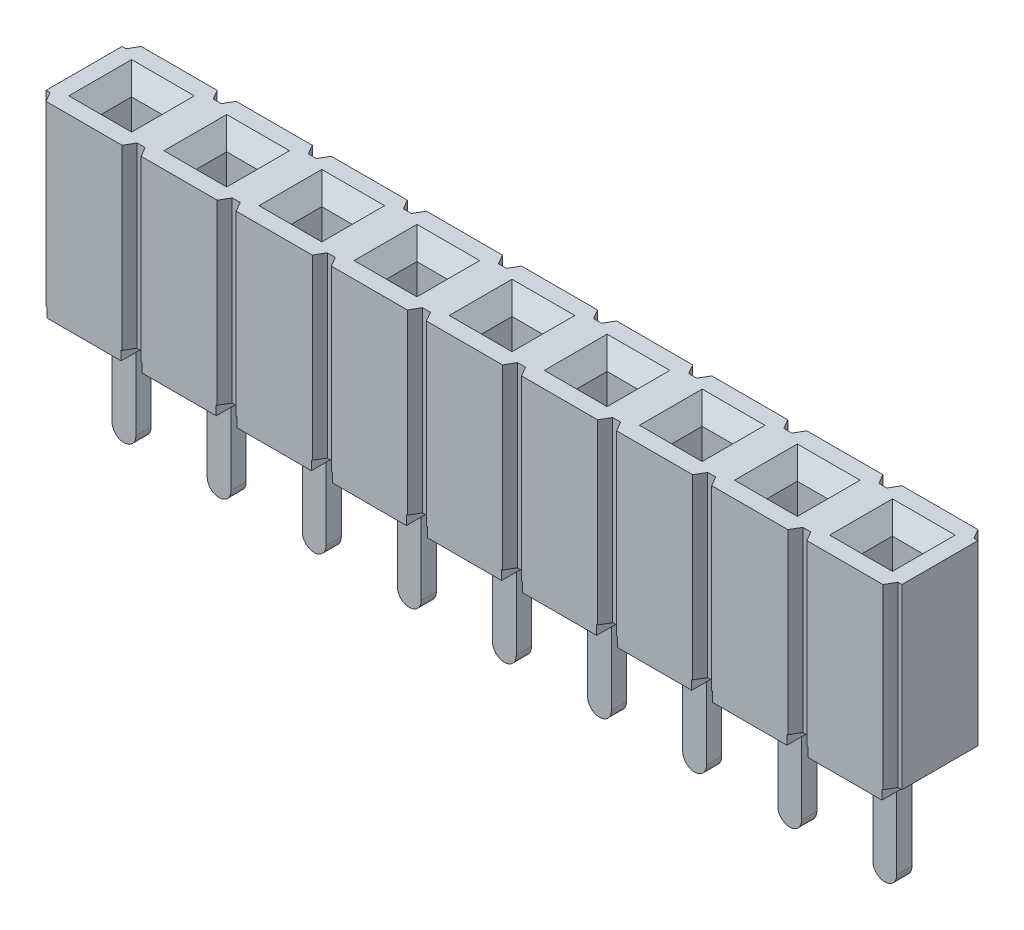
from build123d import *

# Parameters (mm, degrees)
SKETCH1_W                      = 40.64
SKETCH1_H                      = 2.54
BASE_EXTRUDE_DEPTH             = 5
SKETCH2_W                      = 1.524
SKETCH2_H                      = 0.254
STANDOFF_WIDTH_DEPTH           = 41.966114046
UPPER_START                    = -19.4945
UPPER_CORE_OUTLINE_W           = 3.3528
UPPER_CORE_OUTLINE_H           = 0.889
UPPER_CORE_DEPTH               = 0.889
LEAD_IN_SIZE                   = 0.3937
LEAD_IN_SIZE2                  = 0.469193389
CORE_PATTERN_COUNT             = 16
CORE_PATTERN_PITCH             = 2.54
LEAD_IN_OF_CORE_PATTERN_SIZE2  = 0.469193389
LEAD_IN_OF_CORE_PATTERN_SIZE   = 0.3937
POSITION_CUT_DEPTH             = 21.964620197
SKETCH10_W                     = 0.2794
SKETCH10_H                     = 0.254
STANDOFF_LENGTH_DEPTH          = 22.07970588
STANDOFF_PATTERN_COUNT         = 16
STANDOFF_PATTERN_PITCH         = 2.54
SKETCH11_W                     = 0.635
SKETCH11_H                     = 0.4064
TAIL_DEPTH                     = 3.175
TAIL_FILLETS_R                 = 0.3175
TAIL_PATTERN_COUNT             = 16
TAIL_PATTERN_PITCH             = 2.54
TAIL_FILLETS_OF_TAIL_PATTERN_R = 0.3175
SKETCH12_W                     = 17.78
SKETCH12_H                     = 7.921
CUT_EXTRUDE1_DEPTH             = 22.07970588


# Read off the part's stored shape, not the designer's step: Upper Core
with BuildPart() as part:
    # Sketch1 → Base-Extrude (new body)
    with BuildSketch(Plane(origin=(0, 0, 0), x_dir=(1, 0, 0), z_dir=(0, 1, 0))):
        Rectangle(SKETCH1_W, SKETCH1_H)
    extrude(amount=BASE_EXTRUDE_DEPTH)

    # Sketch2 → Standoff - Width (cut, through all)
    with BuildSketch(Plane.ZY.offset(20.32)):
        with Locations((0, 0.127)):
            Rectangle(SKETCH2_W, SKETCH2_H)
    extrude(amount=-STANDOFF_WIDTH_DEPTH, mode=Mode.SUBTRACT)

    # Upper Core outline → Upper Core (cut)
    with BuildSketch(Plane.YZ.offset(UPPER_START)):
        with Locations((3.3236, 0)):
            Rectangle(UPPER_CORE_OUTLINE_W, UPPER_CORE_OUTLINE_H)
    upper_core = extrude(amount=UPPER_CORE_DEPTH, mode=Mode.SUBTRACT)

    # Lead-in
    lead_in_edges = [part.edges().sort_by_distance(p)[0] for p in [
        (-19.4945, 5, 0),
        (-19.05, 5, 0.4445),
        (-18.6055, 5, 0),
        (-19.05, 5, -0.4445),
    ]]
    lead_in_side = [part.faces().sort_by_distance(p)[0] for p in [
        (0.146976854, 5, 0),
    ]]
    chamfer(lead_in_edges, length=LEAD_IN_SIZE, length2=LEAD_IN_SIZE2, reference=lead_in_side[0])

    # Core Pattern: Upper Core ×16
    with Locations(*[(i * CORE_PATTERN_PITCH, 0, 0) for i in range(1, CORE_PATTERN_COUNT)]):
        add(upper_core, mode=Mode.SUBTRACT)

    # Lead-in of Core Pattern
    lead_in_of_core_pattern_edges = [part.edges().sort_by_distance(p)[0] for p in [
        (-16.9545, 5, 0),
        (-16.51, 5, 0.4445),
        (-16.0655, 5, 0),
        (-16.51, 5, -0.4445),
        (-14.4145, 5, 0),
        (-13.97, 5, 0.4445),
        (-13.5255, 5, 0),
        (-13.97, 5, -0.4445),
        (-11.8745, 5, 0),
        (-11.43, 5, 0.4445),
        (-10.9855, 5, 0),
        (-11.43, 5, -0.4445),
        (-9.3345, 5, 0),
        (-8.89, 5, 0.4445),
        (-8.4455, 5, 0),
        (-8.89, 5, -0.4445),
        (-6.7945, 5, 0),
        (-6.35, 5, 0.4445),
        (-5.9055, 5, 0),
        (-6.35, 5, -0.4445),
        (-4.2545, 5, 0),
        (-3.81, 5, 0.4445),
        (-3.3655, 5, 0),
        (-3.81, 5, -0.4445),
        (-1.7145, 5, 0),
        (-1.27, 5, 0.4445),
        (-0.8255, 5, 0),
        (-1.27, 5, -0.4445),
        (0.8255, 5, 0),
        (1.27, 5, 0.4445),
        (1.7145, 5, 0),
        (1.27, 5, -0.4445),
        (3.3655, 5, 0),
        (3.81, 5, 0.4445),
        (4.2545, 5, 0),
        (3.81, 5, -0.4445),
        (5.9055, 5, 0),
        (6.35, 5, 0.4445),
        (6.7945, 5, 0),
        (6.35, 5, -0.4445),
        (8.4455, 5, 0),
        (8.89, 5, 0.4445),
        (9.3345, 5, 0),
        (8.89, 5, -0.4445),
        (10.9855, 5, 0),
        (11.43, 5, 0.4445),
        (11.8745, 5, 0),
        (11.43, 5, -0.4445),
        (13.5255, 5, 0),
        (13.97, 5, 0.4445),
        (14.4145, 5, 0),
        (13.97, 5, -0.4445),
        (16.0655, 5, 0),
        (16.51, 5, 0.4445),
        (16.9545, 5, 0),
        (16.51, 5, -0.4445),
        (18.6055, 5, 0),
        (19.05, 5, 0.4445),
        (19.4945, 5, 0),
        (19.05, 5, -0.4445),
    ]]
    chamfer(lead_in_of_core_pattern_edges, length=LEAD_IN_OF_CORE_PATTERN_SIZE, length2=LEAD_IN_OF_CORE_PATTERN_SIZE2)

    # Sketch4 → Position Cut (cut, through all)
    with BuildSketch(Plane(origin=(0, 5, 0), x_dir=(-1, 0, 0), z_dir=(0, 1, 0))):
        Polygon((20.32, 1.016), (20.212646968, 1.016), (20.066, 1.27), (20.32, 1.27), align=None)
        Polygon((20.066, -1.27), (20.32, -1.27), (20.32, -1.016), (20.212646968, -1.016), align=None)
        Polygon((17.78, -1.016), (17.887353032, -1.016), (18.034, -1.27), (17.78, -1.27), align=None)
        Polygon((18.034, 1.27), (17.78, 1.27), (17.78, 1.016), (17.887353032, 1.016), align=None)
    position_cut = extrude(amount=-POSITION_CUT_DEPTH, mode=Mode.SUBTRACT)

    # Sketch10 → Standoff - Length (cut, through all)
    with BuildSketch(Plane.XY.offset(1.27)):
        with Locations((-17.9197, 0.127)):
            Rectangle(SKETCH10_W, SKETCH10_H)
        with Locations((-20.1803, 0.127)):
            Rectangle(SKETCH10_W, SKETCH10_H)
    standoff_length = extrude(amount=-STANDOFF_LENGTH_DEPTH, mode=Mode.SUBTRACT)

    # Standoff Pattern: Position Cut, Standoff - Length ×16
    with Locations(*[(i * STANDOFF_PATTERN_PITCH, 0, 0) for i in range(1, STANDOFF_PATTERN_COUNT)]):
        add(position_cut, mode=Mode.SUBTRACT)
        add(standoff_length, mode=Mode.SUBTRACT)

    # Sketch11 → Tail (add)
    with BuildSketch(Plane.XZ.offset(-0.254)):
        with Locations((-19.05, 0)):
            Rectangle(SKETCH11_W, SKETCH11_H)
    tail = extrude(amount=TAIL_DEPTH)

    # Tail Fillets
    tail_fillets_edges = [part.edges().sort_by_distance(p)[0] for p in [
        (-19.3675, -2.921, 0),
        (-18.7325, -2.921, 0),
    ]]
    fillet(tail_fillets_edges, radius=TAIL_FILLETS_R - 0.0001)  # a hair under: the kernel refuses the full size

    # Tail Pattern: Tail ×16
    with Locations(*[(i * TAIL_PATTERN_PITCH, 0, 0) for i in range(1, TAIL_PATTERN_COUNT)]):
        add(tail)

    # Tail Fillets of Tail Pattern
    tail_fillets_of_tail_pattern_edges = [part.edges().sort_by_distance(p)[0] for p in [
        (-16.8275, -2.921, 0),
        (-16.1925, -2.921, 0),
        (-14.2875, -2.921, 0),
        (-13.6525, -2.921, 0),
        (-11.7475, -2.921, 0),
        (-11.1125, -2.921, 0),
        (-9.2075, -2.921, 0),
        (-8.5725, -2.921, 0),
        (-6.6675, -2.921, 0),
        (-6.0325, -2.921, 0),
        (-4.1275, -2.921, 0),
        (-3.4925, -2.921, 0),
        (-1.5875, -2.921, 0),
        (-0.9525, -2.921, 0),
        (0.9525, -2.921, 0),
        (1.5875, -2.921, 0),
        (3.4925, -2.921, 0),
        (4.1275, -2.921, 0),
        (6.0325, -2.921, 0),
        (6.6675, -2.921, 0),
        (8.5725, -2.921, 0),
        (9.2075, -2.921, 0),
        (11.1125, -2.921, 0),
        (11.7475, -2.921, 0),
        (13.6525, -2.921, 0),
        (14.2875, -2.921, 0),
        (16.1925, -2.921, 0),
        (16.8275, -2.921, 0),
        (18.7325, -2.921, 0),
        (19.3675, -2.921, 0),
    ]]
    fillet(tail_fillets_of_tail_pattern_edges, radius=TAIL_FILLETS_OF_TAIL_PATTERN_R - 0.0001)  # a hair under: the kernel refuses the full size

    # Sketch12 → Cut-Extrude1 (cut, through all)
    with BuildSketch(Plane.XY.offset(1.27)):
        with Locations((11.43, 1.0395)):
            Rectangle(SKETCH12_W, SKETCH12_H)
    extrude(amount=-CUT_EXTRUDE1_DEPTH, mode=Mode.SUBTRACT)


solid = part.part
